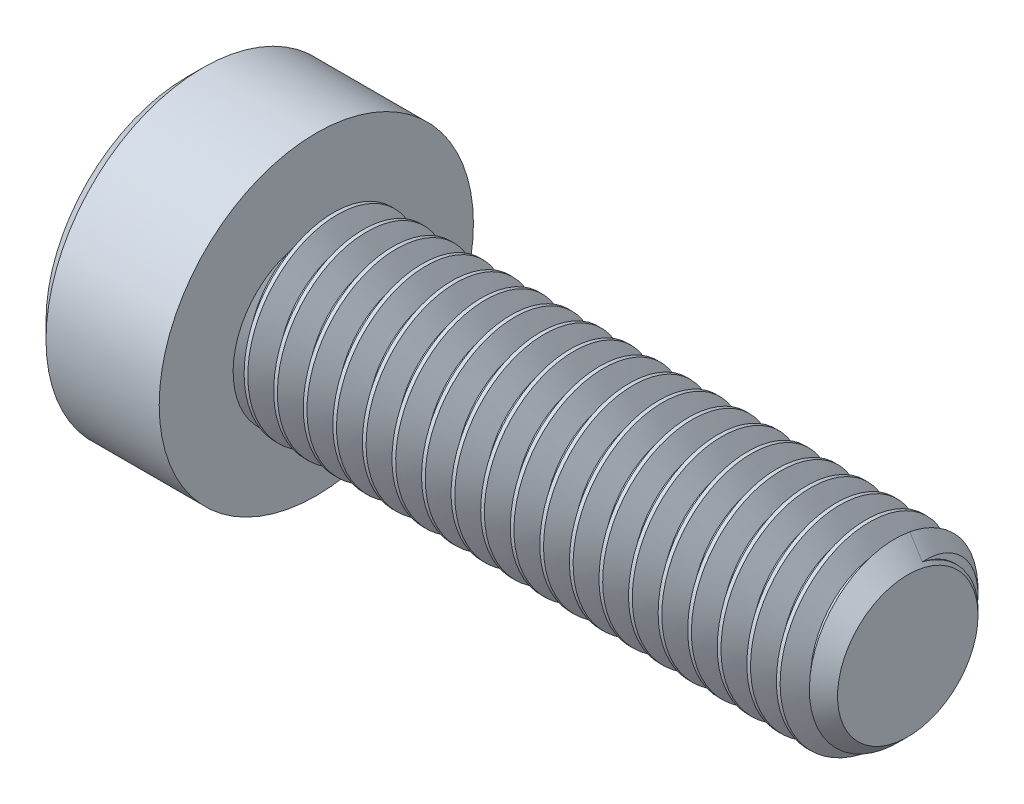
from build123d import *

# Parameters (mm, degrees)
SKETCH2_R           = 2.5
BOSS_EXTRUDE1_DEPTH = 16
CHAMFER1_SIZE       = 0.6
CUT_SWEEP1_PITCH    = 0.8
CUT_EXTRUDE1_DEPTH  = 2.82


with BuildPart() as part:
    # Sketch2 → Boss-Extrude1 (new body)
    with BuildSketch(Plane(origin=(8, 0, 0), x_dir=(0, 0, -1), z_dir=(1, 0, 0))):
        Circle(SKETCH2_R)
    extrude(amount=-BOSS_EXTRUDE1_DEPTH)

    # Chamfer1
    chamfer1_edges = [part.edges().sort_by_distance(p)[0] for p in [
        (8, 0, 2.5),
    ]]
    chamfer(chamfer1_edges, length=CHAMFER1_SIZE)

    # Cut-Sweep1: arcs per turn and ends read off the stored shape
    # Cut-Sweep1: the profile of Sketch5 profile screwed along a right-hand helix through 21 turns, 8 arcs to a turn; built about Z, then put on its axis
    cut_sweep1_z = Axis((0, 0, 0), (0, 0, 1))
    cut_sweep1_corners = [(2.5003, 0, 0.350173205), (2.5003, 0, -0.350173205), (1.980384758, 0, -0.05), (1.980384758, 0, 0.05)]
    with BuildLine(mode=Mode.PRIVATE) as cut_sweep1_profile:
        Line(cut_sweep1_corners[0], cut_sweep1_corners[1])
        Line(cut_sweep1_corners[1], cut_sweep1_corners[2])
        Line(cut_sweep1_corners[2], cut_sweep1_corners[3])
        Line(cut_sweep1_corners[3], cut_sweep1_corners[0])
    cut_sweep1_cap = Face(cut_sweep1_profile.wire())
    cut_sweep1_turn_angles = [0, 22.5, 45, 67.5, 90, 112.5, 135, 157.5, 180, 202.5, 225, 247.5, 270, 292.5, 315, 337.5, 360]
    cut_sweep1_turn_weights = [1, 0.9238795325112867, 1, 0.9238795325112867, 1, 0.9238795325112867, 1, 0.9238795325112867, 1, 0.9238795325112867, 1, 0.9238795325112867, 1, 0.9238795325112867, 1, 0.9238795325112867, 1]
    cut_sweep1_turn_rails = [Edge.make_bspline([Vector(p[0], p[1], 0).rotate(cut_sweep1_z, cut_sweep1_turn_angles[k]) / cut_sweep1_turn_weights[k] + Vector(0, 0, p[2] + CUT_SWEEP1_PITCH * cut_sweep1_turn_angles[k] / 360) for k in range(17)], [0, 0, 0, 1, 1, 2, 2, 3, 3, 4, 4, 5, 5, 6, 6, 7, 7, 8, 8, 8], 2, cut_sweep1_turn_weights) for p in cut_sweep1_corners]
    cut_sweep1_turn_sides = [Face.make_surface_from_curves(cut_sweep1_turn_rails[p[0]], cut_sweep1_turn_rails[p[1]]) for p in [(0, 1), (1, 2), (2, 3), (3, 0)]]
    cut_sweep1 = Plane(origin=(8, 0, 0), x_dir=(0, 1, 0), z_dir=(-1, 0, 0)) * Solid(Shell([*[p.moved(Location((0, 0, CUT_SWEEP1_PITCH * i))) for i in range(21) for p in cut_sweep1_turn_sides], cut_sweep1_cap, cut_sweep1_cap.rotate(cut_sweep1_z, 7560).moved(Location((0, 0, CUT_SWEEP1_PITCH * 7560 / 360)))]))
    add(cut_sweep1, mode=Mode.SUBTRACT)

    # Sketch6 → Revolve1 (revolve)
    with BuildSketch(Plane.XY, mode=Mode.PRIVATE) as revolve1_sk:
        Polygon((-11.0625, 4.25), (-11.5, 3.8125), (-11.5, 0), (-8, 0), (-8, 4.25), align=None)
    revolve(revolve1_sk.sketch.rotate(Axis((-8, 0, 0), (-1, 0, 0)), 13.865622854), axis=Axis((-8, 0, 0), (-1, 0, 0)))

    # Sketch4 → Cut-Extrude1 (cut)
    with BuildSketch(Plane(origin=(-11.5, 0, 0), x_dir=(0, 0, -1), z_dir=(1, 0, 0))):
        Polygon((0, 1.732050808), (-1.5, 0.866025404), (-1.5, -0.866025404), (0, -1.732050808), (1.5, -0.866025404), (1.5, 0.866025404), align=None)
    extrude(amount=CUT_EXTRUDE1_DEPTH, mode=Mode.SUBTRACT)

    # Cut-Extrude2 cone 1 section (through the dimple's axis) → Cut-Extrude2 (revolve, cut)
    with BuildSketch(Plane(origin=(-11.5, 0, 0), x_dir=(0, 0, 1), z_dir=(0, 1, 0))):
        Polygon((0, 0), (1.732050808, 0), (0, 1.732050808), align=None)
    revolve(axis=Axis((-11.5, 0, 0), (1, 0, 0)), mode=Mode.SUBTRACT)


solid = part.part
